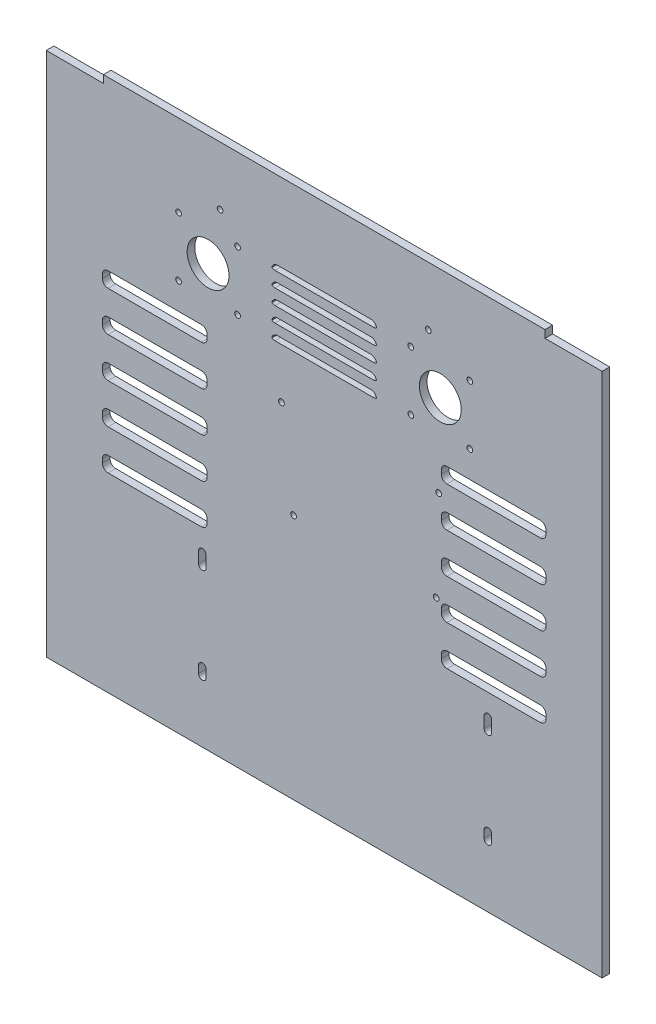
from build123d import *

# Parameters (mm, degrees)
SKETCH1_R           = 1.5
SKETCH1_R_2         = 11
BOSS_EXTRUDE1_DEPTH = 4


with BuildPart() as part:
    # Sketch1 → Boss-Extrude1 (new body)
    with BuildSketch(Plane.XY):
        Polygon((-146, -123.5), (146, -123.5), (146, 152.5), (116, 152.5), (116, 156.5), (-116, 156.5), (-116, 152.5), (-146, 152.5), align=None)
        with BuildLine():
            ThreePointArc((-62, -91), (-64, -93), (-66, -91))
            Line((-66, -91), (-66, -87.07834269))
            ThreePointArc((-66, -87.07834269), (-64, -85.07834269), (-62, -87.07834269))
            Line((-62, -87.07834269), (-62, -91))
        make_face(mode=Mode.SUBTRACT)
        with BuildLine():
            ThreePointArc((-64.5, -15.5), (-62.378679656, -16.378679656), (-61.5, -18.5))
            Line((-61.5, -18.5), (-61.5, -20.5))
            ThreePointArc((-61.5, -20.5), (-62.378679656, -22.621320344), (-64.5, -23.5))
            Line((-64.5, -23.5), (-113.5, -23.5))
            ThreePointArc((-113.5, -23.5), (-115.621320344, -22.621320344), (-116.5, -20.5))
            Line((-116.5, -20.5), (-116.5, -18.5))
            ThreePointArc((-116.5, -18.5), (-115.621320344, -16.378679656), (-113.5, -15.5))
            Line((-113.5, -15.5), (-64.5, -15.5))
        make_face(mode=Mode.SUBTRACT)
        with BuildLine():
            ThreePointArc((-64.5, 5.5), (-62.378679656, 4.621320344), (-61.5, 2.5))
            Line((-61.5, 2.5), (-61.5, 0.5))
            ThreePointArc((-61.5, 0.5), (-62.378679656, -1.621320344), (-64.5, -2.5))
            Line((-64.5, -2.5), (-113.5, -2.5))
            ThreePointArc((-113.5, -2.5), (-115.621320344, -1.621320344), (-116.5, 0.5))
            Line((-116.5, 0.5), (-116.5, 2.5))
            ThreePointArc((-116.5, 2.5), (-115.621320344, 4.621320344), (-113.5, 5.5))
            Line((-113.5, 5.5), (-64.5, 5.5))
        make_face(mode=Mode.SUBTRACT)
        with BuildLine():
            ThreePointArc((-62, -41), (-64, -43), (-66, -41))
            Line((-66, -41), (-66, -35.07834269))
            ThreePointArc((-66, -35.07834269), (-64, -33.07834269), (-62, -35.07834269))
            Line((-62, -35.07834269), (-62, -41))
        make_face(mode=Mode.SUBTRACT)
        with Locations((-16.078681203, 5.935129713)):
            Circle(SKETCH1_R, mode=Mode.SUBTRACT)
        with BuildLine():
            ThreePointArc((88, -91), (86, -93), (84, -91))
            Line((84, -91), (84, -87.07834269))
            ThreePointArc((84, -87.07834269), (86, -85.07834269), (88, -87.07834269))
            Line((88, -87.07834269), (88, -91))
        make_face(mode=Mode.SUBTRACT)
        with Locations((58.851318797, 5.935129713)):
            Circle(SKETCH1_R, mode=Mode.SUBTRACT)
        with BuildLine():
            ThreePointArc((88, -41), (86, -43), (84, -41))
            Line((84, -41), (84, -35.07834269))
            ThreePointArc((84, -35.07834269), (86, -33.07834269), (88, -35.07834269))
            Line((88, -35.07834269), (88, -41))
        make_face(mode=Mode.SUBTRACT)
        with BuildLine():
            Line((64.5, -15.5), (113.5, -15.5))
            ThreePointArc((113.5, -15.5), (115.621320344, -16.378679656), (116.5, -18.5))
            Line((116.5, -18.5), (116.5, -20.5))
            ThreePointArc((116.5, -20.5), (115.621320344, -22.621320344), (113.5, -23.5))
            Line((113.5, -23.5), (64.5, -23.5))
            ThreePointArc((64.5, -23.5), (62.378679656, -22.621320344), (61.5, -20.5))
            Line((61.5, -20.5), (61.5, -18.5))
            ThreePointArc((61.5, -18.5), (62.378679656, -16.378679656), (64.5, -15.5))
        make_face(mode=Mode.SUBTRACT)
        with BuildLine():
            Line((64.5, 5.5), (113.5, 5.5))
            ThreePointArc((113.5, 5.5), (115.621320344, 4.621320344), (116.5, 2.5))
            Line((116.5, 2.5), (116.5, 0.5))
            ThreePointArc((116.5, 0.5), (115.621320344, -1.621320344), (113.5, -2.5))
            Line((113.5, -2.5), (64.5, -2.5))
            ThreePointArc((64.5, -2.5), (62.378679656, -1.621320344), (61.5, 0.5))
            Line((61.5, 0.5), (61.5, 2.5))
            ThreePointArc((61.5, 2.5), (62.378679656, 4.621320344), (64.5, 5.5))
        make_face(mode=Mode.SUBTRACT)
        with BuildLine():
            ThreePointArc((-64.5, 26.5), (-62.378679656, 25.621320344), (-61.5, 23.5))
            Line((-61.5, 23.5), (-61.5, 21.5))
            ThreePointArc((-61.5, 21.5), (-62.378679656, 19.378679656), (-64.5, 18.5))
            Line((-64.5, 18.5), (-113.5, 18.5))
            ThreePointArc((-113.5, 18.5), (-115.621320344, 19.378679656), (-116.5, 21.5))
            Line((-116.5, 21.5), (-116.5, 23.5))
            ThreePointArc((-116.5, 23.5), (-115.621320344, 25.621320344), (-113.5, 26.5))
            Line((-113.5, 26.5), (-64.5, 26.5))
        make_face(mode=Mode.SUBTRACT)
        with BuildLine():
            ThreePointArc((-64.5, 47.5), (-62.378679656, 46.621320344), (-61.5, 44.5))
            Line((-61.5, 44.5), (-61.5, 42.5))
            ThreePointArc((-61.5, 42.5), (-62.378679656, 40.378679656), (-64.5, 39.5))
            Line((-64.5, 39.5), (-113.5, 39.5))
            ThreePointArc((-113.5, 39.5), (-115.621320344, 40.378679656), (-116.5, 42.5))
            Line((-116.5, 42.5), (-116.5, 44.5))
            ThreePointArc((-116.5, 44.5), (-115.621320344, 46.621320344), (-113.5, 47.5))
            Line((-113.5, 47.5), (-64.5, 47.5))
        make_face(mode=Mode.SUBTRACT)
        with BuildLine():
            ThreePointArc((-64.5, 68.5), (-62.378679656, 67.621320344), (-61.5, 65.5))
            Line((-61.5, 65.5), (-61.5, 63.5))
            ThreePointArc((-61.5, 63.5), (-62.378679656, 61.378679656), (-64.5, 60.5))
            Line((-64.5, 60.5), (-113.5, 60.5))
            ThreePointArc((-113.5, 60.5), (-115.621320344, 61.378679656), (-116.5, 63.5))
            Line((-116.5, 63.5), (-116.5, 65.5))
            ThreePointArc((-116.5, 65.5), (-115.621320344, 67.621320344), (-113.5, 68.5))
            Line((-113.5, 68.5), (-64.5, 68.5))
        make_face(mode=Mode.SUBTRACT)
        with Locations((-76.5, 82.5)):
            Circle(SKETCH1_R, mode=Mode.SUBTRACT)
        with Locations((-45.5, 82.5)):
            Circle(SKETCH1_R, mode=Mode.SUBTRACT)
        with Locations((-22.428681203, 54.195129713)):
            Circle(SKETCH1_R, mode=Mode.SUBTRACT)
        with Locations((-76.5, 113.5)):
            Circle(SKETCH1_R, mode=Mode.SUBTRACT)
        with Locations((-61, 98)):
            Circle(SKETCH1_R_2, mode=Mode.SUBTRACT)
        with Locations((-45.5, 113.5)):
            Circle(SKETCH1_R, mode=Mode.SUBTRACT)
        with BuildLine():
            ThreePointArc((-27.5, 113), (-26.478451782, 114.791287847), (-24.541960108, 115.5))
            Line((-24.541960108, 115.5), (24.541960108, 115.5))
            ThreePointArc((24.541960108, 115.5), (26.478451782, 114.791287847), (27.5, 113))
            ThreePointArc((27.5, 113), (26.707713009, 112.627718677), (25.841687605, 112.5))
            Line((25.841687605, 112.5), (-25.841687605, 112.5))
            ThreePointArc((-25.841687605, 112.5), (-26.707713009, 112.627718677), (-27.5, 113))
        make_face(mode=Mode.SUBTRACT)
        with BuildLine():
            ThreePointArc((-27.5, 81), (-26.478451782, 82.791287847), (-24.541960108, 83.5))
            Line((-24.541960108, 83.5), (24.541960108, 83.5))
            ThreePointArc((24.541960108, 83.5), (26.478451782, 82.791287847), (27.5, 81))
            ThreePointArc((27.5, 81), (26.707713009, 80.627718677), (25.841687605, 80.5))
            Line((25.841687605, 80.5), (-25.841687605, 80.5))
            ThreePointArc((-25.841687605, 80.5), (-26.707713009, 80.627718677), (-27.5, 81))
        make_face(mode=Mode.SUBTRACT)
        with Locations((60.121318797, 54.195129713)):
            Circle(SKETCH1_R, mode=Mode.SUBTRACT)
        with Locations((45.5, 82.5)):
            Circle(SKETCH1_R, mode=Mode.SUBTRACT)
        with BuildLine():
            Line((64.5, 26.5), (113.5, 26.5))
            ThreePointArc((113.5, 26.5), (115.621320344, 25.621320344), (116.5, 23.5))
            Line((116.5, 23.5), (116.5, 21.5))
            ThreePointArc((116.5, 21.5), (115.621320344, 19.378679656), (113.5, 18.5))
            Line((113.5, 18.5), (64.5, 18.5))
            ThreePointArc((64.5, 18.5), (62.378679656, 19.378679656), (61.5, 21.5))
            Line((61.5, 21.5), (61.5, 23.5))
            ThreePointArc((61.5, 23.5), (62.378679656, 25.621320344), (64.5, 26.5))
        make_face(mode=Mode.SUBTRACT)
        with BuildLine():
            Line((64.5, 47.5), (113.5, 47.5))
            ThreePointArc((113.5, 47.5), (115.621320344, 46.621320344), (116.5, 44.5))
            Line((116.5, 44.5), (116.5, 42.5))
            ThreePointArc((116.5, 42.5), (115.621320344, 40.378679656), (113.5, 39.5))
            Line((113.5, 39.5), (64.5, 39.5))
            ThreePointArc((64.5, 39.5), (62.378679656, 40.378679656), (61.5, 42.5))
            Line((61.5, 42.5), (61.5, 44.5))
            ThreePointArc((61.5, 44.5), (62.378679656, 46.621320344), (64.5, 47.5))
        make_face(mode=Mode.SUBTRACT)
        with BuildLine():
            Line((64.5, 68.5), (113.5, 68.5))
            ThreePointArc((113.5, 68.5), (115.621320344, 67.621320344), (116.5, 65.5))
            Line((116.5, 65.5), (116.5, 63.5))
            ThreePointArc((116.5, 63.5), (115.621320344, 61.378679656), (113.5, 60.5))
            Line((113.5, 60.5), (64.5, 60.5))
            ThreePointArc((64.5, 60.5), (62.378679656, 61.378679656), (61.5, 63.5))
            Line((61.5, 63.5), (61.5, 65.5))
            ThreePointArc((61.5, 65.5), (62.378679656, 67.621320344), (64.5, 68.5))
        make_face(mode=Mode.SUBTRACT)
        with Locations((76.5, 82.5)):
            Circle(SKETCH1_R, mode=Mode.SUBTRACT)
        with BuildLine():
            ThreePointArc((-27.5, 89), (-26.478451782, 90.791287847), (-24.541960108, 91.5))
            Line((-24.541960108, 91.5), (24.541960108, 91.5))
            ThreePointArc((24.541960108, 91.5), (26.478451782, 90.791287847), (27.5, 89))
            ThreePointArc((27.5, 89), (26.707713009, 88.627718677), (25.841687605, 88.5))
            Line((25.841687605, 88.5), (-25.841687605, 88.5))
            ThreePointArc((-25.841687605, 88.5), (-26.707713009, 88.627718677), (-27.5, 89))
        make_face(mode=Mode.SUBTRACT)
        with BuildLine():
            ThreePointArc((-27.5, 97), (-26.478451782, 98.791287847), (-24.541960108, 99.5))
            Line((-24.541960108, 99.5), (24.541960108, 99.5))
            ThreePointArc((24.541960108, 99.5), (26.478451782, 98.791287847), (27.5, 97))
            ThreePointArc((27.5, 97), (26.707713009, 96.627718677), (25.841687605, 96.5))
            Line((25.841687605, 96.5), (-25.841687605, 96.5))
            ThreePointArc((-25.841687605, 96.5), (-26.707713009, 96.627718677), (-27.5, 97))
        make_face(mode=Mode.SUBTRACT)
        with BuildLine():
            ThreePointArc((-27.5, 105), (-26.478451782, 106.791287847), (-24.541960108, 107.5))
            Line((-24.541960108, 107.5), (24.541960108, 107.5))
            ThreePointArc((24.541960108, 107.5), (26.478451782, 106.791287847), (27.5, 105))
            ThreePointArc((27.5, 105), (26.707713009, 104.627718677), (25.841687605, 104.5))
            Line((25.841687605, 104.5), (-25.841687605, 104.5))
            ThreePointArc((-25.841687605, 104.5), (-26.707713009, 104.627718677), (-27.5, 105))
        make_face(mode=Mode.SUBTRACT)
        with Locations((61, 98)):
            Circle(SKETCH1_R_2, mode=Mode.SUBTRACT)
        with Locations((45.5, 113.5)):
            Circle(SKETCH1_R, mode=Mode.SUBTRACT)
        with Locations((76.5, 113.5)):
            Circle(SKETCH1_R, mode=Mode.SUBTRACT)
        with Locations((54.7, 125.75)):
            Circle(SKETCH1_R, mode=Mode.SUBTRACT)
        with Locations((-54.7, 125.75)):
            Circle(SKETCH1_R, mode=Mode.SUBTRACT)
    extrude(amount=BOSS_EXTRUDE1_DEPTH)


solid = part.part
